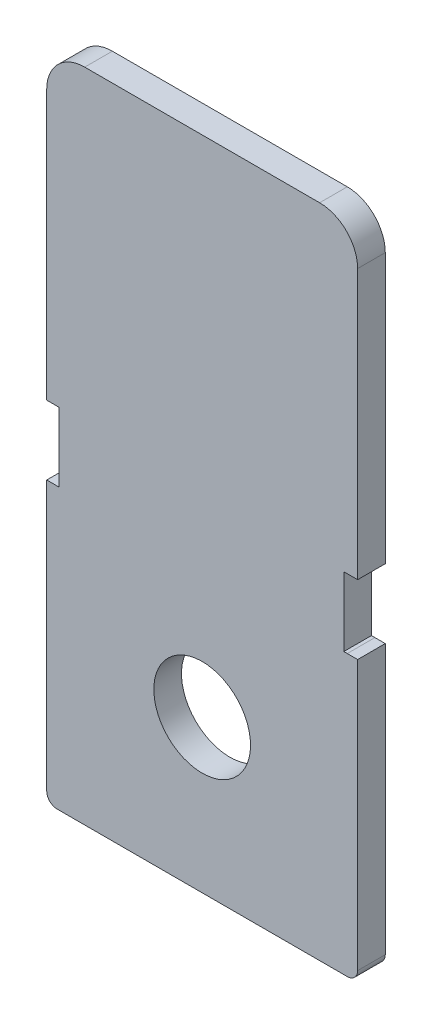
from build123d import *

# Parameters (mm, degrees)
SKETCH1_W                = 20
SKETCH1_H                = 20
SKETCH1_R                = 4
SKETCH1_H_2              = 10
BOSS_EXTRUDE2_DEPTH      = 2
SKETCH2_W                = 45
SKETCH2_H                = 60
SKETCH2_W_2              = 43
SKETCH2_H_2              = 58
BOSS_EXTRUDE3_DEPTH      = 4
SKETCH6_W                = 45
SKETCH6_H                = 30
BOSS_EXTRUDE4_DEPTH      = 2
CUT_EXTRUDE4_DEPTH       = 4
BOSS_EXTRUDE5_DEPTH      = 7
BOSS_EXTRUDE5_2_DEPTH    = 7
BOSS_EXTRUDE5_3_DEPTH    = 7
SKETCH11_W               = 19
SKETCH11_H               = 19
BOSS_EXTRUDE6_DEPTH      = 2
SKETCH14_R               = 4
CUT_EXTRUDE7_DEPTH       = 19
SKETCH15_W               = 1
SKETCH15_H               = 17
SKETCH15_H_2             = 1
BOSS_EXTRUDE7_DEPTH      = 80
SKETCH16_W               = 16.5
SKETCH16_H               = 16.5
BOSS_EXTRUDE8_DEPTH      = 80
SKETCH17_R               = 4
CUT_EXTRUDE8_DEPTH       = 193
SKETCH18_W               = 105.72576136
SKETCH18_H               = 91
CUT_EXTRUDE9_DEPTH       = 193
SKETCH19_W               = 10.5
SKETCH19_H               = 2
CUT_EXTRUDE10_DEPTH      = 193
SKETCH20_W               = 16.5
SKETCH20_H               = 16.5
SKETCH20_R               = 4
BOSS_EXTRUDE10_DEPTH     = 80
SKETCH21_W               = 16.5
SKETCH21_H               = 16.5
SKETCH21_R               = 4
CUT_EXTRUDE11_DEPTH      = 80
SKETCH22_W               = 14
SKETCH22_H               = 5
CUT_EXTRUDE12_DEPTH      = 16
SKETCH24_W               = 16.5
SKETCH24_H               = 80
SKETCH24_W_2             = 14
SKETCH24_H_2             = 5
BOSS_EXTRUDE11_DEPTH     = 2
SKETCH25_R               = 4.1
SKETCH25_R_2             = 4
CUT_EXTRUDE14_DEPTH      = 103
SKETCH26_W               = 35
SKETCH26_H               = 40
BOSS_EXTRUDE12_DEPTH     = 5
SKETCH27_W               = 23
SKETCH27_H               = 5.75
CUT_EXTRUDE17_DEPTH      = 5
SKETCH28_W               = 2
SKETCH28_H               = 40
BOSS_EXTRUDE13_DEPTH     = 32
SKETCH29_W               = 4
SKETCH29_H               = 40
CUT_EXTRUDE18_DEPTH      = 32
SKETCH30_W               = 4
SKETCH30_H               = 40
CUT_EXTRUDE19_DEPTH      = 32
SKETCH31_W               = 10
SKETCH31_H               = 2
CUT_EXTRUDE20_DEPTH      = 32
SKETCH34_W               = 44.25
SKETCH34_H               = 2
BOSS_EXTRUDE15_DEPTH     = 23
FILLET1_R                = 3
FILLET2_R                = 3
FILLET3_R                = 3
FILLET4_R                = 3
BOSS_EXTRUDE16_DEPTH     = 20
SKETCH36_W               = 10
SKETCH36_H               = 2
BOSS_EXTRUDE17_DEPTH     = 23
SKETCH37_W               = 27
SKETCH37_H               = 20
CUT_EXTRUDE23_DEPTH      = 1
SKETCH42_W               = 1
SKETCH42_H               = 5
BOSS_EXTRUDE22_DEPTH     = 2
SKETCH44_W               = 1
SKETCH44_H               = 2
BOSS_EXTRUDE23_DEPTH     = 2
SKETCH46_W               = 1
SKETCH46_H               = 2
BOSS_EXTRUDE24_DEPTH     = 3
SKETCH47_W               = 16.5
SKETCH47_H               = 18.5
SKETCH47_R               = 4.1
BOSS_EXTRUDE25_DEPTH     = 2
SKETCH50_W               = 14
SKETCH50_H               = 18
SKETCH50_R               = 4.1
CUT_EXTRUDE26_DEPTH      = 2
SKETCH51_W               = 18
SKETCH51_H               = 7
CUT_EXTRUDE27_DEPTH      = 0.5
SKETCH52_W               = 18
SKETCH52_H               = 7
CUT_EXTRUDE28_DEPTH      = 0.5
SKETCH53_W               = 18.5
SKETCH53_H               = 82
BOSS_EXTRUDE26_DEPTH     = 0.5
SKETCH54_W               = 18.5
SKETCH54_H               = 82
BOSS_EXTRUDE27_DEPTH     = 0.5
BOSS_EXTRUDE30_DEPTH     = 5
CUT_EXTRUDE31_REACH      = 138.104
SKETCH61_W               = 23
SKETCH61_H               = 5
CUT_EXTRUDE32_DEPTH      = 25
CUT_EXTRUDE32_DEPTH_BACK = 5
SKETCH62_W               = 6.75
SKETCH62_H               = 5
BOSS_EXTRUDE31_DEPTH     = 10.25
BOSS_EXTRUDE32_DEPTH     = 6
SKETCH65_W               = 23
SKETCH65_H               = 2
BOSS_EXTRUDE33_DEPTH     = 6
FILLET5_R                = 3
FILLET6_R                = 3
FILLET7_R                = 1
FILLET8_R                = 1
SKETCH66_W               = 1
SKETCH66_H               = 1
CUT_EXTRUDE33_DEPTH      = 5
BOSS_EXTRUDE34_DEPTH     = 6
SKETCH68_W               = 17
SKETCH68_H               = 15
BOSS_EXTRUDE35_DEPTH     = 6
BOSS_EXTRUDE37_DEPTH     = 15
SKETCH72_W               = 3
SKETCH72_H               = 15
BOSS_EXTRUDE38_DEPTH     = 3
SKETCH75_W               = 6.5
SKETCH75_H               = 31.5
BOSS_EXTRUDE39_DEPTH     = 2
SKETCH76_W               = 6.5
SKETCH76_H               = 2
BOSS_EXTRUDE40_DEPTH     = 31.5
SKETCH77_W               = 1
SKETCH77_H               = 5.002530781
SKETCH77_H_2             = 5
CUT_EXTRUDE34_DEPTH      = 8
SKETCH78_W               = 0.75
SKETCH78_H               = 5.002565684
SKETCH78_H_2             = 5
CUT_EXTRUDE35_DEPTH      = 2
SKETCH79_W               = 0.75
SKETCH79_H               = 5.002530781
SKETCH79_W_2             = 0.875
SKETCH79_H_2             = 5
BOSS_EXTRUDE42_DEPTH     = 2
SKETCH80_R               = 3.5
CUT_EXTRUDE37_DEPTH      = 2
CUT_EXTRUDE38_DEPTH      = 32


with BuildPart() as part:
    # Sketch1 → Boss-Extrude2 (new body)
    # profile 1 of 6: a face of its own
    with BuildSketch(Plane(origin=(0, 0, 0), x_dir=(1, 0, 0), z_dir=(0, 1, 0))):
        Polygon((-22.5, 10), (-10, 10), (10, 10), (22.5, 10), (22.5, 70), (-22.5, 70), align=None)
    # profile 2 of 6: a face of its own
    with BuildSketch(Plane(origin=(0, 0, 0), x_dir=(1, 0, 0), z_dir=(0, 1, 0))):
        Polygon((-22.5, 10), (-10, -10), (-10, 10), align=None)
    # profile 3 of 6: a face of its own
    with BuildSketch(Plane(origin=(0, 0, 0), x_dir=(1, 0, 0), z_dir=(0, 1, 0))):
        Polygon((10, 10), (10, -10), (22.5, 10), align=None)
    # profile 4 of 6: a face of its own
    with BuildSketch(Plane(origin=(0, 0, 0), x_dir=(1, 0, 0), z_dir=(0, 1, 0))):
        Rectangle(SKETCH1_W, SKETCH1_H)
        Circle(SKETCH1_R, mode=Mode.SUBTRACT)
    # profile 5 of 6: a face of its own
    with BuildSketch(Plane(origin=(0, 0, 0), x_dir=(1, 0, 0), z_dir=(0, 1, 0))):
        Circle(SKETCH1_R)
    # profile 6 of 6: a face of its own
    with BuildSketch(Plane(origin=(0, 0, 0), x_dir=(1, 0, 0), z_dir=(0, 1, 0))):
        with Locations((0, -15)):
            Rectangle(SKETCH1_W, SKETCH1_H_2)
    extrude(amount=BOSS_EXTRUDE2_DEPTH)

    # Sketch2 → Boss-Extrude3 (add)
    with BuildSketch(Plane(origin=(0, 2, 0), x_dir=(1, 0, 0), z_dir=(0, 1, 0))):
        with Locations((0, 40)):
            Rectangle(SKETCH2_W, SKETCH2_H)
        with Locations((0, 40)):
            Rectangle(SKETCH2_W_2, SKETCH2_H_2, mode=Mode.SUBTRACT)
    extrude(amount=BOSS_EXTRUDE3_DEPTH)

    # Sketch6 → Boss-Extrude4 (add)
    with BuildSketch(Plane(origin=(0, 2, 0), x_dir=(1, 0, 0), z_dir=(0, 1, 0))):
        with Locations((0, -5)):
            Rectangle(SKETCH6_W, SKETCH6_H)
    extrude(amount=-BOSS_EXTRUDE4_DEPTH)

    # Sketch7 → Cut-Extrude4 (cut)
    with BuildSketch(Plane(origin=(0, 2, 0), x_dir=(1, 0, 0), z_dir=(0, 1, 0))):
        with BuildLine():
            Line((9.5, 9.5), (-9.5, 9.5))
            Line((-9.5, 9.5), (-9.5, 2.122498999))
            ThreePointArc((-9.5, 2.122498999), (0, 9), (9.5, 2.122498999))
            Line((9.5, 2.122498999), (9.5, 9.5))
        make_face()
        with BuildLine():
            ThreePointArc((-5.267826876, -9.5), (-7.858215886, -7.184532568), (-9.5, -4.122498999))
            Line((-9.5, -4.122498999), (-9.5, -9.5))
            Line((-9.5, -9.5), (-5.267826876, -9.5))
        make_face()
        with BuildLine():
            Line((9.5, -9.5), (9.5, -4.122498999))
            ThreePointArc((9.5, -4.122498999), (7.858215886, -7.184532568), (5.267826876, -9.5))
            Line((5.267826876, -9.5), (9.5, -9.5))
        make_face()
    extrude(amount=-CUT_EXTRUDE4_DEPTH, mode=Mode.SUBTRACT)


with BuildPart() as body_2:
    # Sketch8 → Boss-Extrude5 (new body)
    with BuildSketch(Plane(origin=(0, 2, 0), x_dir=(1, 0, 0), z_dir=(0, 1, 0))):
        with BuildLine():
            Line((9.5, 2.122498999), (9.5, 9.5))
            Line((9.5, 9.5), (-9.5, 9.5))
            Line((-9.5, 9.5), (-9.5, 2.122498999))
            ThreePointArc((-9.5, 2.122498999), (0, 9), (9.5, 2.122498999))
        make_face()
    extrude(amount=BOSS_EXTRUDE5_DEPTH)



with BuildPart() as body_3:
    # Sketch8 → Boss-Extrude5 2 (new body)
    with BuildSketch(Plane(origin=(0, 2, 0), x_dir=(1, 0, 0), z_dir=(0, 1, 0))):
        with BuildLine():
            Line((-9.5, -9.5), (-5.267826876, -9.5))
            ThreePointArc((-5.267826876, -9.5), (-7.858215886, -7.184532568), (-9.5, -4.122498999))
            Line((-9.5, -4.122498999), (-9.5, -9.5))
        make_face()
    extrude(amount=BOSS_EXTRUDE5_2_DEPTH)


with BuildPart() as body_4:
    # Sketch8 → Boss-Extrude5 3 (new body)
    with BuildSketch(Plane(origin=(0, 2, 0), x_dir=(1, 0, 0), z_dir=(0, 1, 0))):
        with BuildLine():
            Line((9.5, -9.5), (9.5, -4.122498999))
            ThreePointArc((9.5, -4.122498999), (7.858215886, -7.184532568), (5.267826876, -9.5))
            Line((5.267826876, -9.5), (9.5, -9.5))
        make_face()
    extrude(amount=BOSS_EXTRUDE5_3_DEPTH)


with BuildPart() as body_2_1:
    add(body_2.part)

    add(body_3.part)  # Boss-Extrude6 merges body 3

    add(body_4.part)  # Boss-Extrude6 merges body 4
    # Sketch11 → Boss-Extrude6 (add)
    with BuildSketch(Plane(origin=(0, 9, 0), x_dir=(1, 0, 0), z_dir=(0, 1, 0))):
        Rectangle(SKETCH11_W, SKETCH11_H)
    extrude(amount=BOSS_EXTRUDE6_DEPTH)


with BuildPart() as cut_extrude7_tool:
    # Sketch14 → Cut-Extrude7 (new body)
    with BuildSketch(Plane.XZ):
        with Locations(Location((0, 1, 0), (0, 0, 270))):
            Circle(SKETCH14_R)
    extrude(amount=-CUT_EXTRUDE7_DEPTH)


with BuildPart() as part_1:
    add(part.part)

    # Cut-Extrude7: cut by cut_extrude7_tool
    add(cut_extrude7_tool.part, mode=Mode.SUBTRACT)


with BuildPart() as body_2_2:
    add(body_2_1.part)

    # Cut-Extrude7: cut by cut_extrude7_tool
    add(cut_extrude7_tool.part, mode=Mode.SUBTRACT)

    # Sketch15 → Boss-Extrude7 (add)
    with BuildSketch(Plane(origin=(0, 11, 0), x_dir=(1, 0, 0), z_dir=(0, 1, 0))):
        Polygon((-8.5, 8.5), (8.5, 8.5), (8.5, 9.5), (-9.5, 9.5), (-9.5, -9.5), (8.5, -9.5), (8.5, -8.5), (-8.5, -8.5), align=None)
        with Locations((9, 0)):
            Rectangle(SKETCH15_W, SKETCH15_H)
        with Locations((9, 9)):
            Rectangle(SKETCH15_W, SKETCH15_H_2)
        with Locations((9, -9)):
            Rectangle(SKETCH15_W, SKETCH15_H_2)
    extrude(amount=BOSS_EXTRUDE7_DEPTH)


with BuildPart() as body_3_2:
    # Sketch16 → Boss-Extrude8 (new body)
    with BuildSketch(Plane(origin=(0, 91, 0), x_dir=(1, 0, 0), z_dir=(0, 1, 0))):
        Rectangle(SKETCH16_W, SKETCH16_H)
    extrude(amount=BOSS_EXTRUDE8_DEPTH)

    # Sketch17 → Cut-Extrude8 (cut)
    with BuildSketch(Plane.XZ):
        with Locations(Location((0, 1, 0), (0, 0, 270))):
            Circle(SKETCH17_R)
    extrude(amount=-CUT_EXTRUDE8_DEPTH, mode=Mode.SUBTRACT)

    # Sketch20 → Boss-Extrude10 (add)
    with BuildSketch(Plane.XZ.offset(-91)):
        Rectangle(SKETCH20_W, SKETCH20_H)
        with Locations(Location((0, 1, 0), (0, 0, 270))):
            Circle(SKETCH20_R, mode=Mode.SUBTRACT)
    extrude(amount=BOSS_EXTRUDE10_DEPTH)

    # Sketch21 → Cut-Extrude11 (cut)
    with BuildSketch(Plane(origin=(0, 171, 0), x_dir=(1, 0, 0), z_dir=(0, 1, 0))):
        Rectangle(SKETCH21_W, SKETCH21_H)
        with Locations(Location((0, -1, 0), (0, 0, 90))):
            Circle(SKETCH21_R, mode=Mode.SUBTRACT)
    extrude(amount=-CUT_EXTRUDE11_DEPTH, mode=Mode.SUBTRACT)

    # Sketch22 → Cut-Extrude12 (cut)
    with BuildSketch(Plane.XY.offset(8.25)):
        with Locations((0, 15.5)):
            Rectangle(SKETCH22_W, SKETCH22_H)
    extrude(amount=-CUT_EXTRUDE12_DEPTH, mode=Mode.SUBTRACT)

    # Sketch24 → Boss-Extrude11 (add)
    with BuildSketch(Plane.XY.offset(8.25)):
        with Locations((0, 51)):
            Rectangle(SKETCH24_W, SKETCH24_H)
        with Locations((0, 15.5)):
            Rectangle(SKETCH24_W_2, SKETCH24_H_2, mode=Mode.SUBTRACT)
    extrude(amount=BOSS_EXTRUDE11_DEPTH)

    # Sketch25 → Cut-Extrude14 (cut)
    with BuildSketch(Plane(origin=(0, 91, 0), x_dir=(1, 0, 0), z_dir=(0, 1, 0))):
        with Locations(Location((0, -1, 0), (0, 0, 270))):
            Circle(SKETCH25_R)
        with Locations((0, -1)):
            Circle(SKETCH25_R_2, mode=Mode.SUBTRACT)
    extrude(amount=-CUT_EXTRUDE14_DEPTH, mode=Mode.SUBTRACT)

    # Sketch26 → Boss-Extrude12 (add)
    with BuildSketch(Plane(origin=(0, 91, 0), x_dir=(1, 0, 0), z_dir=(0, 1, 0))):
        Rectangle(SKETCH26_W, SKETCH26_H)
    extrude(amount=BOSS_EXTRUDE12_DEPTH)

    # Sketch27 → Cut-Extrude17 (cut)
    with BuildSketch(Plane(origin=(0, 96, 0), x_dir=(1, 0, 0), z_dir=(0, 1, 0))):
        with Locations((0, -17.125)):
            Rectangle(SKETCH27_W, SKETCH27_H)
    extrude(amount=-CUT_EXTRUDE17_DEPTH, mode=Mode.SUBTRACT)

    # Sketch28 → Boss-Extrude13 (add)
    with BuildSketch(Plane(origin=(0, 96, 0), x_dir=(1, 0, 0), z_dir=(0, 1, 0))):
        with Locations((12.5, 0)):
            Rectangle(SKETCH28_W, SKETCH28_H)
        with Locations((-12.5, 0)):
            Rectangle(SKETCH28_W, SKETCH28_H)
    extrude(amount=BOSS_EXTRUDE13_DEPTH)

    # Sketch29 → Cut-Extrude18 (cut)
    with BuildSketch(Plane(origin=(0, 96, 0), x_dir=(1, 0, 0), z_dir=(0, 1, 0))):
        with Locations((-15.5, 0)):
            Rectangle(SKETCH29_W, SKETCH29_H)
    extrude(amount=-CUT_EXTRUDE18_DEPTH, mode=Mode.SUBTRACT)

    # Sketch30 → Cut-Extrude19 (cut)
    with BuildSketch(Plane(origin=(0, 96, 0), x_dir=(1, 0, 0), z_dir=(0, 1, 0))):
        with Locations((15.5, 0)):
            Rectangle(SKETCH30_W, SKETCH30_H)
    extrude(amount=-CUT_EXTRUDE19_DEPTH, mode=Mode.SUBTRACT)

    # Sketch31 → Cut-Extrude20 (cut)
    with BuildSketch(Plane(origin=(0, 96, 0), x_dir=(1, 0, 0), z_dir=(0, 1, 0))):
        with Locations((0, 19)):
            Rectangle(SKETCH31_W, SKETCH31_H)
    extrude(amount=-CUT_EXTRUDE20_DEPTH, mode=Mode.SUBTRACT)

    # Sketch34 → Boss-Extrude15 (add)
    with BuildSketch(Plane.ZY.offset(-11.5)):
        with Locations((2.125, 127)):
            Rectangle(SKETCH34_W, SKETCH34_H)
    extrude(amount=BOSS_EXTRUDE15_DEPTH)

    # Fillet1
    fillet1_edges = [body_3_2.edges().sort_by_distance(p)[0] for p in [
        (-13.5, 128, 0),
    ]]
    fillet(fillet1_edges, radius=FILLET1_R)

    # Fillet2
    fillet2_edges = [body_3_2.edges().sort_by_distance(p)[0] for p in [
        (13.5, 128, 0),
    ]]
    fillet(fillet2_edges, radius=FILLET2_R)

    # Fillet3
    # the kernel refuses this fillet: 3 mm, written as the material it adds along each edge
    with BuildSketch(Plane(origin=(-11.5, 126, 27.5), x_dir=(1, 0, 0), z_dir=(0, 0, -1))) as fillet3_piece_1_section:
        with BuildLine():
            CenterArc((FILLET3_R, FILLET3_R), FILLET3_R, 180, 90)
            Line((0, FILLET3_R), (0, 0))
            Line((0, 0), (FILLET3_R, 0))
        make_face()
    fillet3_piece_1 = extrude(amount=47.5, mode=Mode.PRIVATE)
    fillet3_piece_1 = split(fillet3_piece_1, bisect_by=Plane(origin=(-11.5, 126, 24.25), z_dir=(0, 0, -1)), keep=Keep.TOP, mode=Mode.PRIVATE)
    fillet3_piece_1 = split(fillet3_piece_1, bisect_by=Plane(origin=(-11.5, 126, 27.5), z_dir=(1, 0, 0)), keep=Keep.TOP, mode=Mode.PRIVATE)
    fillet3_piece_1 = split(fillet3_piece_1, bisect_by=Plane(origin=(-11.5, 126, 20), z_dir=(0, 0, 1)), keep=Keep.TOP, mode=Mode.PRIVATE)
    add(fillet3_piece_1)
    with BuildSketch(Plane(origin=(-11.5, 126, 20), x_dir=(1, 0, 0), z_dir=(0, 0, -1))) as fillet3_piece_2_section:
        with BuildLine():
            CenterArc((FILLET3_R, FILLET3_R), FILLET3_R, 180, 90)
            Line((0, FILLET3_R), (0, 0))
            Line((0, 0), (FILLET3_R, 0))
        make_face()
    fillet3_piece_2 = extrude(amount=40, mode=Mode.PRIVATE)
    fillet3_piece_2 = split(fillet3_piece_2, bisect_by=Plane(origin=(-11.5, 126, 20), z_dir=(1, 0, 0)), keep=Keep.TOP, mode=Mode.PRIVATE)
    add(fillet3_piece_2)

    # Fillet4
    # the kernel refuses this fillet: 3 mm, written as the material it adds along each edge
    with BuildSketch(Plane(origin=(11.5, 126, 27.5), x_dir=(0, -1, 0), z_dir=(0, 0, -1))) as fillet4_piece_1_section:
        with BuildLine():
            CenterArc((FILLET4_R, FILLET4_R), FILLET4_R, 180, 90)
            Line((0, FILLET4_R), (0, 0))
            Line((0, 0), (FILLET4_R, 0))
        make_face()
    fillet4_piece_1 = extrude(amount=47.5, mode=Mode.PRIVATE)
    fillet4_piece_1 = split(fillet4_piece_1, bisect_by=Plane(origin=(11.5, 126, 20), z_dir=(0, 0, 1)), keep=Keep.TOP, mode=Mode.PRIVATE)
    fillet4_piece_1 = split(fillet4_piece_1, bisect_by=Plane(origin=(11.5, 126, 27.5), z_dir=(-1, 0, 0)), keep=Keep.TOP, mode=Mode.PRIVATE)
    fillet4_piece_1 = split(fillet4_piece_1, bisect_by=Plane(origin=(11.5, 126, 24.25), z_dir=(0, 0, -1)), keep=Keep.TOP, mode=Mode.PRIVATE)
    add(fillet4_piece_1)
    with BuildSketch(Plane(origin=(11.5, 126, 20), x_dir=(0, -1, 0), z_dir=(0, 0, -1))) as fillet4_piece_2_section:
        with BuildLine():
            CenterArc((FILLET4_R, FILLET4_R), FILLET4_R, 180, 90)
            Line((0, FILLET4_R), (0, 0))
            Line((0, 0), (FILLET4_R, 0))
        make_face()
    fillet4_piece_2 = extrude(amount=40, mode=Mode.PRIVATE)
    fillet4_piece_2 = split(fillet4_piece_2, bisect_by=Plane(origin=(11.5, 126, 20), z_dir=(-1, 0, 0)), keep=Keep.TOP, mode=Mode.PRIVATE)
    add(fillet4_piece_2)

    # Boss-Extrude16: read off the stored shape, not the designer's step
    # Boss-Extrude16 outline → Boss-Extrude16 (add)
    with BuildSketch(Plane.XZ.offset(-91)):
        Polygon((11.5, 20), (11.5, 14.25), (-11.5, 14.25), (-11.5, 20), (-13.5, 20), (-13.5, 12.25), (13.5, 12.25), (13.5, 20), align=None)
    extrude(amount=BOSS_EXTRUDE16_DEPTH)

    # Sketch36 → Boss-Extrude17 (add)
    with BuildSketch(Plane.ZY.offset(-11.5)):
        with Locations((19.25, 72)):
            Rectangle(SKETCH36_W, SKETCH36_H)
    extrude(amount=BOSS_EXTRUDE17_DEPTH)

    # Sketch37 → Cut-Extrude23 (cut)
    with BuildSketch(Plane(origin=(0, 0, 12.25), x_dir=(-1, 0, 0), z_dir=(0, 0, -1))):
        with Locations((0, 81)):
            Rectangle(SKETCH37_W, SKETCH37_H)
    extrude(amount=-CUT_EXTRUDE23_DEPTH, mode=Mode.SUBTRACT)

    # Sketch47 → Boss-Extrude25 (add)
    with BuildSketch(Plane.XZ.offset(-11)):
        with Locations((0, 1)):
            Rectangle(SKETCH47_W, SKETCH47_H)
        with Locations(Location((0, 1, 0), (0, 0, 90))):
            Circle(SKETCH47_R, mode=Mode.SUBTRACT)
    extrude(amount=BOSS_EXTRUDE25_DEPTH)

    # Sketch50 → Cut-Extrude26 (cut)
    with BuildSketch(Plane(origin=(0, 13, 0), x_dir=(1, 0, 0), z_dir=(0, 1, 0))):
        with Locations((0, -1.25)):
            Rectangle(SKETCH50_W, SKETCH50_H)
        with Locations(Location((0, -1, 0), (0, 0, 270))):
            Circle(SKETCH50_R, mode=Mode.SUBTRACT)
    extrude(amount=-CUT_EXTRUDE26_DEPTH, mode=Mode.SUBTRACT)

    # Sketch51 → Cut-Extrude27 (cut)
    with BuildSketch(Plane(origin=(-7, 0, 0), x_dir=(0, 0, -1), z_dir=(1, 0, 0))):
        with Locations((-1.25, 14.5)):
            Rectangle(SKETCH51_W, SKETCH51_H)
    extrude(amount=-CUT_EXTRUDE27_DEPTH, mode=Mode.SUBTRACT)

    # Sketch52 → Cut-Extrude28 (cut)
    with BuildSketch(Plane.ZY.offset(-7)):
        with Locations((1.25, 14.5)):
            Rectangle(SKETCH52_W, SKETCH52_H)
    extrude(amount=-CUT_EXTRUDE28_DEPTH, mode=Mode.SUBTRACT)

    # Sketch53 → Boss-Extrude26 (add)
    with BuildSketch(Plane.ZY.offset(8.25)):
        with Locations((1, 50)):
            Rectangle(SKETCH53_W, SKETCH53_H)
    extrude(amount=BOSS_EXTRUDE26_DEPTH)

    # Sketch54 → Boss-Extrude27 (add)
    with BuildSketch(Plane(origin=(8.25, 0, 0), x_dir=(0, 0, -1), z_dir=(1, 0, 0))):
        with Locations((-1, 50)):
            Rectangle(SKETCH54_W, SKETCH54_H)
    extrude(amount=BOSS_EXTRUDE27_DEPTH)

    # Sketch59 → Boss-Extrude30 (add)
    with BuildSketch(Plane(origin=(0, 73, 0), x_dir=(1, 0, 0), z_dir=(0, 1, 0))):
        Polygon((-11.5, -20), (-11.5, -24.25), (11.5, -24.25), (11.5, -20), (11.5, -14.25), (-11.5, -14.25), align=None)
    extrude(amount=BOSS_EXTRUDE30_DEPTH)

    # Cut-Extrude31: up to this face of the body (flat: up to its plane)
    cut_extrude31_end = Plane(body_3_2.part.faces().sort_by_distance((0, 81, 13.25))[0])
    # Sketch61 → Cut-Extrude31 (cut, up to the picked face)
    with BuildSketch(Plane.XY.offset(24.25), mode=Mode.PRIVATE) as cut_extrude31_sk1:
        with Locations((0, 73.5)):
            Rectangle(SKETCH61_W, SKETCH61_H)
    cut_extrude31_tool1 = split(extrude(cut_extrude31_sk1.sketch, amount=-CUT_EXTRUDE31_REACH, mode=Mode.PRIVATE), bisect_by=cut_extrude31_end, keep=Keep.BOTH, mode=Mode.PRIVATE)
    add(cut_extrude31_tool1.solids().sort_by(Axis((0, 73.5, 24.25), (0, 0, -1)))[0], mode=Mode.SUBTRACT)

    # Sketch62 → Cut-Extrude32 (cut, two sides: drawn at the far end of the back side and taken through both)
    with BuildSketch(Plane(origin=(-11.5, 0, 0), x_dir=(0, 0, -1), z_dir=(1, 0, 0)).offset(-CUT_EXTRUDE32_DEPTH_BACK)):
        with Locations((-16.625, 73.5)):
            Rectangle(SKETCH62_W, SKETCH62_H)
    extrude(amount=CUT_EXTRUDE32_DEPTH + CUT_EXTRUDE32_DEPTH_BACK, mode=Mode.SUBTRACT)



with BuildPart() as cut_extrude9_tool:
    # Sketch18 → Cut-Extrude9 (new body)
    with BuildSketch(Plane.ZY.offset(22.5)):
        with Locations((-43.36288068, 45.5)):
            Rectangle(SKETCH18_W, SKETCH18_H)
    extrude(amount=-CUT_EXTRUDE9_DEPTH)


with BuildPart() as part_2:
    add(part_1.part)

    # Cut-Extrude9: cut by cut_extrude9_tool
    add(cut_extrude9_tool.part, mode=Mode.SUBTRACT)

    # Sketch19 → Cut-Extrude10 (cut)
    with BuildSketch(Plane.ZY.offset(22.5)):
        with Locations((14.75, 1)):
            Rectangle(SKETCH19_W, SKETCH19_H)
    extrude(amount=-CUT_EXTRUDE10_DEPTH, mode=Mode.SUBTRACT)


with BuildPart() as body_2_3:
    add(body_2_2.part)

    # Cut-Extrude9: cut by cut_extrude9_tool
    add(cut_extrude9_tool.part, mode=Mode.SUBTRACT)


with BuildPart() as body_2_2_1:
    # Sketch42 → Boss-Extrude22 (new body)
    with BuildSketch(Plane.XY.offset(30.25)):
        with Locations((-11, 101)):
            Rectangle(SKETCH42_W, SKETCH42_H)
    extrude(amount=-BOSS_EXTRUDE22_DEPTH)


with BuildPart() as body_3_3:
    # Sketch44 → Boss-Extrude23 (new body)
    with BuildSketch(Plane.XY.offset(30.25)):
        with Locations((11, 99.5)):
            Rectangle(SKETCH44_W, SKETCH44_H)
    extrude(amount=-BOSS_EXTRUDE23_DEPTH)

    # Sketch46 → Boss-Extrude24 (add)
    with BuildSketch(Plane(origin=(0, 100.5, 0), x_dir=(1, 0, 0), z_dir=(0, 1, 0))):
        with Locations((11, -29.25)):
            Rectangle(SKETCH46_W, SKETCH46_H)
    extrude(amount=BOSS_EXTRUDE24_DEPTH)


with BuildPart() as body_3_2_1:
    add(body_3_2.part)

    add(body_2_2_1.part)  # Boss-Extrude31 merges body 2 2

    add(body_3_3.part)  # Boss-Extrude31 merges body 3 3
    # Sketch63 → Boss-Extrude31 (add)
    with BuildSketch(Plane.XY.offset(20)):
        with BuildLine():
            Line((-13.5, 76), (-11.5, 76))
            Line((-11.5, 76), (-11.5, 78))
            Line((-11.5, 78), (-11.5, 123))
            Line((-11.5, 123), (-11.5, 127.828427125))
            ThreePointArc((-11.5, 127.828427125), (-12.949489743, 126.732050808), (-13.5, 125))
            Line((-13.5, 125), (-13.5, 76))
        make_face()
        with BuildLine():
            Line((11.5, 76), (13.5, 76))
            Line((13.5, 76), (13.5, 125))
            ThreePointArc((13.5, 125), (12.949489743, 126.732050808), (11.5, 127.828427125))
            Line((11.5, 127.828427125), (11.5, 123))
            Line((11.5, 123), (11.5, 78))
            Line((11.5, 78), (11.5, 76))
        make_face()
    extrude(amount=BOSS_EXTRUDE31_DEPTH)


with BuildPart() as boss_extrude32_tool:
    # Sketch64 → Boss-Extrude32 (new body)
    with BuildSketch(Plane.XY.offset(24.25)):
        with BuildLine():
            Line((11.5, 123.000004494), (11.5, 127.828427125))
            ThreePointArc((11.5, 127.828427125), (11.007305936, 127.956795679), (10.5, 128))
            Line((10.5, 128), (-10.5, 128))
            ThreePointArc((-10.5, 128), (-11.007305936, 127.956795679), (-11.5, 127.828427125))
            Line((-11.5, 127.828427125), (-11.5, 123.000004494))
            ThreePointArc((-11.5, 123.000004494), (-10.621318755, 125.121321932), (-8.5, 126))
            Line((-8.5, 126), (8.5, 126))
            ThreePointArc((8.5, 126), (10.621318755, 125.121321932), (11.5, 123.000004494))
        make_face()
    extrude(amount=BOSS_EXTRUDE32_DEPTH)


with BuildPart() as body_3_2_2:
    add(body_3_2_1.part)


with BuildPart() as body_3_2_3:
    # Boss-Extrude32: joined with boss_extrude32_tool
    add(body_3_2_2.part.fuse(boss_extrude32_tool.part, tol=0.00001))

    # Sketch65 → Boss-Extrude33 (add)
    with BuildSketch(Plane.XY.offset(24.25)):
        with Locations((0, 77)):
            Rectangle(SKETCH65_W, SKETCH65_H)
    extrude(amount=BOSS_EXTRUDE33_DEPTH)

    # Fillet5
    fillet5_edges = [body_3_2_3.edges().sort_by_distance(p)[0] for p in [
        (13.5, 76, 21.75),
    ]]
    fillet(fillet5_edges, radius=FILLET5_R)

    # Fillet6
    fillet6_edges = [body_3_2_3.edges().sort_by_distance(p)[0] for p in [
        (-13.5, 76, 21.75),
    ]]
    fillet(fillet6_edges, radius=FILLET6_R)

    # Fillet7
    fillet7_edges = [body_3_2_3.edges().sort_by_distance(p)[0] for p in [
        (-11.5, 78, 22.25),
    ]]
    fillet(fillet7_edges, radius=FILLET7_R)

    # Fillet8
    fillet8_edges = [body_3_2_3.edges().sort_by_distance(p)[0] for p in [
        (11.5, 78, 22.25),
    ]]
    fillet(fillet8_edges, radius=FILLET8_R)

    # Sketch66 → Cut-Extrude33 (cut)
    with BuildSketch(Plane(origin=(0, 103.5, 0), x_dir=(1, 0, 0), z_dir=(0, 1, 0))):
        with Locations((-11, -28.75)):
            Rectangle(SKETCH66_W, SKETCH66_H)
        Polygon((-10.5, -29.25), (-10.5, -30.25), (-11.5, -30.25), align=None)
        Polygon((11.5, -30.25), (10.5, -29.25), (10.5, -30.25), align=None)
        with Locations((11, -28.75)):
            Rectangle(SKETCH66_W, SKETCH66_H)
    extrude(amount=-CUT_EXTRUDE33_DEPTH, mode=Mode.SUBTRACT)

    # Sketch67 → Boss-Extrude34 (add)
    with BuildSketch(Plane(origin=(0, 96, 0), x_dir=(1, 0, 0), z_dir=(0, 1, 0))):
        Polygon((5, 5), (5, 18), (-5, 18), (-5, 20), (-11.5, 20), (-11.5, 5), align=None)
        Polygon((11.5, 20), (5, 20), (5, 18), (5, 5), (11.5, 5), align=None)
    extrude(amount=BOSS_EXTRUDE34_DEPTH)

    # Sketch68 → Boss-Extrude35 (add)
    with BuildSketch(Plane.XZ.offset(-126)):
        with Locations((0, -12.5)):
            Rectangle(SKETCH68_W, SKETCH68_H)
    extrude(amount=BOSS_EXTRUDE35_DEPTH)

    # Sketch71 → Boss-Extrude37 (add)
    with BuildSketch(Plane(origin=(0, 0, -20), x_dir=(-1, 0, 0), z_dir=(0, 0, -1))):
        with BuildLine():
            ThreePointArc((-8.5, 126), (-10.621320344, 125.121320344), (-11.5, 123))
            Line((-11.5, 123), (-8.5, 123))
            Line((-8.5, 123), (-8.5, 126))
        make_face()
        with BuildLine():
            Line((8.5, 123), (11.5, 123))
            ThreePointArc((11.5, 123), (10.621320344, 125.121320344), (8.5, 126))
            Line((8.5, 126), (8.5, 123))
        make_face()
    extrude(amount=-BOSS_EXTRUDE37_DEPTH)

    # Sketch72 → Boss-Extrude38 (add)
    with BuildSketch(Plane.XZ.offset(-123)):
        with Locations((-10, -12.5)):
            Rectangle(SKETCH72_W, SKETCH72_H)
        with Locations((10, -12.5)):
            Rectangle(SKETCH72_W, SKETCH72_H)
    extrude(amount=BOSS_EXTRUDE38_DEPTH)

    # Sketch81 → Cut-Extrude38 (cut)
    with BuildSketch(Plane(origin=(13.5, 0, 0), x_dir=(0, 0, -1), z_dir=(1, 0, 0))):
        Polygon((-30.25, 162.009758307), (-30.25, 125), (20, 125), (70.52683885, 125), (70.52683885, 162.009758307), align=None)
        Polygon((20, 125), (-30.25, 125), (-30.25, 79), (-13.25, 79), (-13.25, 91), (20, 91), align=None)
        Polygon((70.52683885, 125), (20, 125), (20, 91), (-13.25, 91), (-13.25, 79), (-30.25, 79), (-30.25, -38.82202192), (71.500818081, -38.82202192), (71.500818081, 125), align=None)
    extrude(amount=-CUT_EXTRUDE38_DEPTH, mode=Mode.SUBTRACT)


with BuildPart() as body_2_3_1:
    # Sketch75 → Boss-Extrude39 (new body)
    with BuildSketch(Plane.XY.offset(30.25)):
        with BuildLine():
            Line((-10.5, 78.25), (10.5, 78.25))
            ThreePointArc((10.5, 78.25), (11.030330086, 78.469669914), (11.25, 79))
            Line((11.25, 79), (11.25, 98.5))
            Line((11.25, 98.5), (11.25, 103.5))
            Line((11.25, 103.5), (11.25, 123))
            ThreePointArc((11.25, 123), (10.444543648, 124.944543648), (8.5, 125.75))
            Line((8.5, 125.75), (-8.5, 125.75))
            ThreePointArc((-8.5, 125.75), (-10.444542192, 124.944545105), (-11.25, 123.000004119))
            Line((-11.25, 123.000004119), (-11.25, 103.5))
            Line((-11.25, 103.5), (-11.25, 98.5))
            Line((-11.25, 98.5), (-11.25, 79))
            ThreePointArc((-11.25, 79), (-11.030330086, 78.469669914), (-10.5, 78.25))
        make_face()
        with Locations((0, 102)):
            Rectangle(SKETCH75_W, SKETCH75_H, mode=Mode.SUBTRACT)
    extrude(amount=BOSS_EXTRUDE39_DEPTH)

    # Sketch76 → Boss-Extrude40 (add)
    with BuildSketch(Plane(origin=(0, 86.25, 0), x_dir=(1, 0, 0), z_dir=(0, 1, 0))):
        with Locations((0, -31.25)):
            Rectangle(SKETCH76_W, SKETCH76_H)
    extrude(amount=BOSS_EXTRUDE40_DEPTH)

    # Sketch77 → Cut-Extrude34 (cut)
    with BuildSketch(Plane(origin=(0, 0, 29.25), x_dir=(-1, 0, 0), z_dir=(0, 0, -1))):
        with Locations((-10, 100.99873461)):
            Rectangle(SKETCH77_W, SKETCH77_H)
        with Locations((10, 101)):
            Rectangle(SKETCH77_W, SKETCH77_H_2)
    extrude(amount=-CUT_EXTRUDE34_DEPTH, mode=Mode.SUBTRACT)

    # Sketch78 → Cut-Extrude35 (cut)
    with BuildSketch(Plane.XY.offset(32.25)):
        with Locations((10.875, 100.998717158)):
            Rectangle(SKETCH78_W, SKETCH78_H)
        with Locations((-10.875, 101)):
            Rectangle(SKETCH78_W, SKETCH78_H_2)
    extrude(amount=-CUT_EXTRUDE35_DEPTH, mode=Mode.SUBTRACT)

    # Sketch79 → Boss-Extrude42 (add)
    with BuildSketch(Plane.XY.offset(32.25)):
        with Locations((9.875, 100.99873461)):
            Rectangle(SKETCH79_W, SKETCH79_H)
        with Locations((-9.9375, 101)):
            Rectangle(SKETCH79_W_2, SKETCH79_H_2)
    extrude(amount=-BOSS_EXTRUDE42_DEPTH)

    # Sketch80 → Cut-Extrude37 (cut)
    with BuildSketch(Plane.XY.offset(32.25)):
        with Locations((0, 89.25)):
            Circle(SKETCH80_R)
    extrude(amount=-CUT_EXTRUDE37_DEPTH, mode=Mode.SUBTRACT)


solid = body_2_3_1.part
